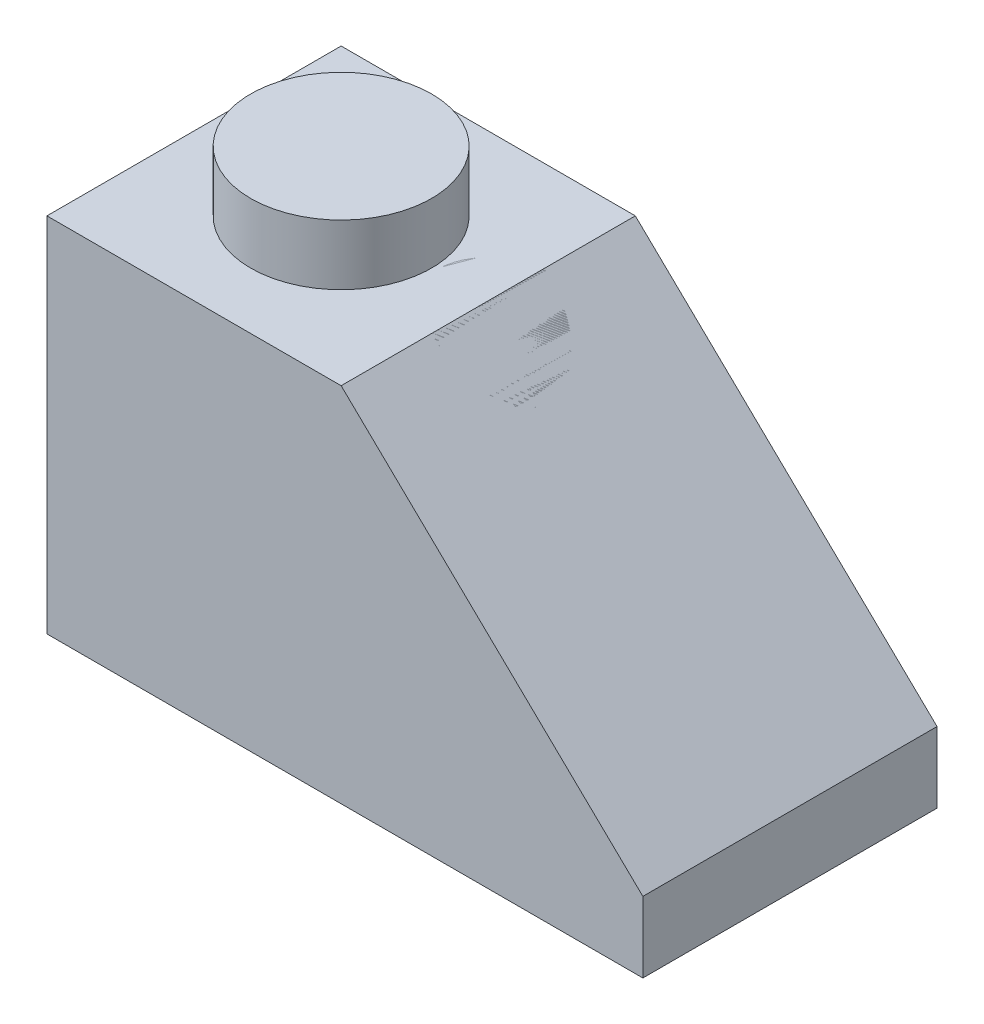
from build123d import *

# Parameters (mm, degrees)
BOSS_EXTRUDE1_DEPTH       = 7.8
BOSS_EXTRUDE2_START       = -7.85489796
BOSS_EXTRUDE2_OUTLINE_R   = 1.5
BOSS_EXTRUDE2_DEPTH       = 7.85489796
BOSS_EXTRUDE2_START_2     = 8.05489796
BOSS_EXTRUDE2_2_OUTLINE_R = 1.5
BOSS_EXTRUDE2_2_DEPTH     = 1.54510204
BOSS_EXTRUDE2_START_3     = 12.323997373
BOSS_EXTRUDE2_3_OUTLINE_W = 6
BOSS_EXTRUDE2_3_OUTLINE_H = 6
BOSS_EXTRUDE2_3_DEPTH     = 1.676002627
SKETCH4_R                 = 2.4
BOSS_EXTRUDE3_DEPTH       = 1.6
SHELL1_T                  = -1.2


with BuildPart() as part:
    # Sketch1 → Boss-Extrude1 (new body)
    with BuildSketch(Plane.XY):
        Polygon((0, 9.6), (7.8, 9.6), (15.8, 1.874489802), (15.8, 0), (0, 0), align=None)
    extrude(amount=-BOSS_EXTRUDE1_DEPTH)

    # Sketch4 → Boss-Extrude3 (add)
    with BuildSketch(Plane(origin=(0, 9.6, 0), x_dir=(1, 0, 0), z_dir=(0, 1, 0))):
        with Locations(Location((3.9, 3.9, 0), (0, 0, 270))):
            Circle(SKETCH4_R)
    extrude(amount=BOSS_EXTRUDE3_DEPTH)

    # Shell1
    shell1_openings = [part.faces().sort_by_distance(p)[0] for p in [
        (7.9, 0, -3.9),
    ]]
    offset(amount=SHELL1_T, openings=shell1_openings, kind=Kind.INTERSECTION)


with BuildPart() as body_2:
    # Boss-Extrude2: read off the stored shape, not the designer's step
    # Boss-Extrude2 outline → Boss-Extrude2 (new body)
    with BuildSketch(Plane(origin=(0, 0.2, 0), x_dir=(-1, 0, 0), z_dir=(0, -1, 0)).offset(BOSS_EXTRUDE2_START)):
        with Locations((-7.9, 3.9)):
            Circle(BOSS_EXTRUDE2_OUTLINE_R)
    extrude(amount=BOSS_EXTRUDE2_DEPTH)

    # Boss-Extrude2 2 outline → Boss-Extrude2 2 (add)
    with BuildSketch(Plane(origin=(0, 0, 0), x_dir=(1, 0, 0), z_dir=(0, 1, 0)).offset(BOSS_EXTRUDE2_START_2)):
        with Locations((7.9, 3.9)):
            Circle(BOSS_EXTRUDE2_2_OUTLINE_R)
    extrude(amount=BOSS_EXTRUDE2_2_DEPTH)

    # Boss-Extrude2 3 outline → Boss-Extrude2 3 (cut)
    with BuildSketch(Plane(origin=(0, 0, 0), x_dir=(0.7193398003386496, -0.6946583704589989, 0), z_dir=(0.6946583704589988, 0.7193398003386497, 0)).offset(BOSS_EXTRUDE2_START_3)):
        with Locations((0, 4)):
            Rectangle(BOSS_EXTRUDE2_3_OUTLINE_W, BOSS_EXTRUDE2_3_OUTLINE_H)
    extrude(amount=BOSS_EXTRUDE2_3_DEPTH, mode=Mode.SUBTRACT)


solid = Compound([part.part, body_2.part])
